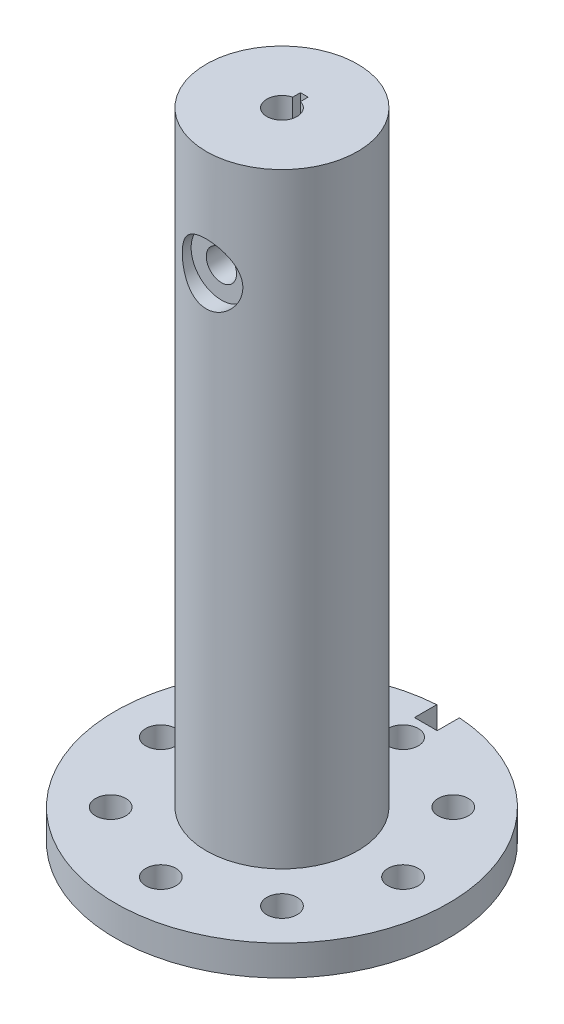
from build123d import *

# Parameters (mm, degrees)
SKETCH1_R               = 11
SKETCH1_R_2             = 1
BOSS_EXTRUDE1_DEPTH     = 2
SKETCH2_R               = 3.5
CUT_EXTRUDE1_DEPTH      = 16.684387141
SKETCH4_W               = 1.5
SKETCH4_H               = 3
CUT_EXTRUDE3_DEPTH      = 4
BOSS_EXTRUDE2_START     = 20
SKETCH5_R               = 5
SKETCH5_R_2             = 3.5
BOSS_EXTRUDE2_DEPTH     = 20
BOSS_EXTRUDE3_START     = 20
SKETCH6_R               = 5
BOSS_EXTRUDE3_DEPTH     = 20
CUT_EXTRUDE4_DEPTH      = 5
CUT_EXTRUDE4_DEPTH_BACK = 1
SKETCH7_R               = 1
SKETCH8_R               = 2
CUT_EXTRUDE5_DEPTH      = 1


with BuildPart() as part:
    # Sketch1 → Boss-Extrude1 (new body)
    with BuildSketch(Plane(origin=(0, 0, 0), x_dir=(1, 0, 0), z_dir=(0, 1, 0))):
        Circle(SKETCH1_R)
        with Locations((0, 8)):
            Circle(SKETCH1_R_2, mode=Mode.SUBTRACT)
        with Locations((5.656854249, 5.656854249)):
            Circle(SKETCH1_R_2, mode=Mode.SUBTRACT)
        with Locations((8, 0)):
            Circle(SKETCH1_R_2, mode=Mode.SUBTRACT)
        with Locations((5.656854249, -5.656854249)):
            Circle(SKETCH1_R_2, mode=Mode.SUBTRACT)
        with Locations((0, -8)):
            Circle(SKETCH1_R_2, mode=Mode.SUBTRACT)
        with Locations((-5.656854249, -5.656854249)):
            Circle(SKETCH1_R_2, mode=Mode.SUBTRACT)
        with Locations((-8, 0)):
            Circle(SKETCH1_R_2, mode=Mode.SUBTRACT)
        with Locations((-5.656854249, 5.656854249)):
            Circle(SKETCH1_R_2, mode=Mode.SUBTRACT)
    extrude(amount=BOSS_EXTRUDE1_DEPTH)

    # Sketch2 → Cut-Extrude1 (cut, through all)
    with BuildSketch(Plane(origin=(0, 2, 0), x_dir=(1, 0, 0), z_dir=(0, 1, 0))):
        Circle(SKETCH2_R)
    extrude(amount=-CUT_EXTRUDE1_DEPTH, mode=Mode.SUBTRACT)

    # Sketch4 → Cut-Extrude3 (cut)
    with BuildSketch(Plane(origin=(0, 2, 0), x_dir=(1, 0, 0), z_dir=(0, 1, 0))):
        with Locations((0, 11)):
            Rectangle(SKETCH4_W, SKETCH4_H)
    extrude(amount=-CUT_EXTRUDE3_DEPTH, mode=Mode.SUBTRACT)

    # Sketch5 → Boss-Extrude2 (add)
    with BuildSketch(Plane(origin=(0, 2, 0), x_dir=(1, 0, 0), z_dir=(0, 1, 0)).offset(BOSS_EXTRUDE2_START)):
        Circle(SKETCH5_R)
        Circle(SKETCH5_R_2, mode=Mode.SUBTRACT)
    extrude(amount=-BOSS_EXTRUDE2_DEPTH)

    # Sketch6 → Boss-Extrude3 (add)
    with BuildSketch(Plane(origin=(0, 22, 0), x_dir=(1, 0, 0), z_dir=(0, 1, 0)).offset(BOSS_EXTRUDE3_START)):
        Circle(SKETCH6_R)
        with BuildLine():
            Line((-0.255, 0.966941053), (-0.255, 1.476941053))
            Line((-0.255, 1.476941053), (0.255, 1.476941053))
            Line((0.255, 1.476941053), (0.255, 0.966941053))
            ThreePointArc((0.255, 0.966941053), (0, -1), (-0.255, 0.966941053))
        make_face(mode=Mode.SUBTRACT)
    extrude(amount=-BOSS_EXTRUDE3_DEPTH)

    # Sketch7 → Cut-Extrude4 (cut, two sides: drawn at the far end of the back side and taken through both)
    with BuildSketch(Plane.XY.offset(-CUT_EXTRUDE4_DEPTH_BACK)):
        with Locations((0, 35)):
            Circle(SKETCH7_R)
    extrude(amount=CUT_EXTRUDE4_DEPTH + CUT_EXTRUDE4_DEPTH_BACK, mode=Mode.SUBTRACT)

    # Sketch8 → Cut-Extrude5 (cut)
    with BuildSketch(Plane.XY.offset(5)):
        with Locations((0, 35)):
            Circle(SKETCH8_R)
    extrude(amount=-CUT_EXTRUDE5_DEPTH, mode=Mode.SUBTRACT)


solid = part.part
